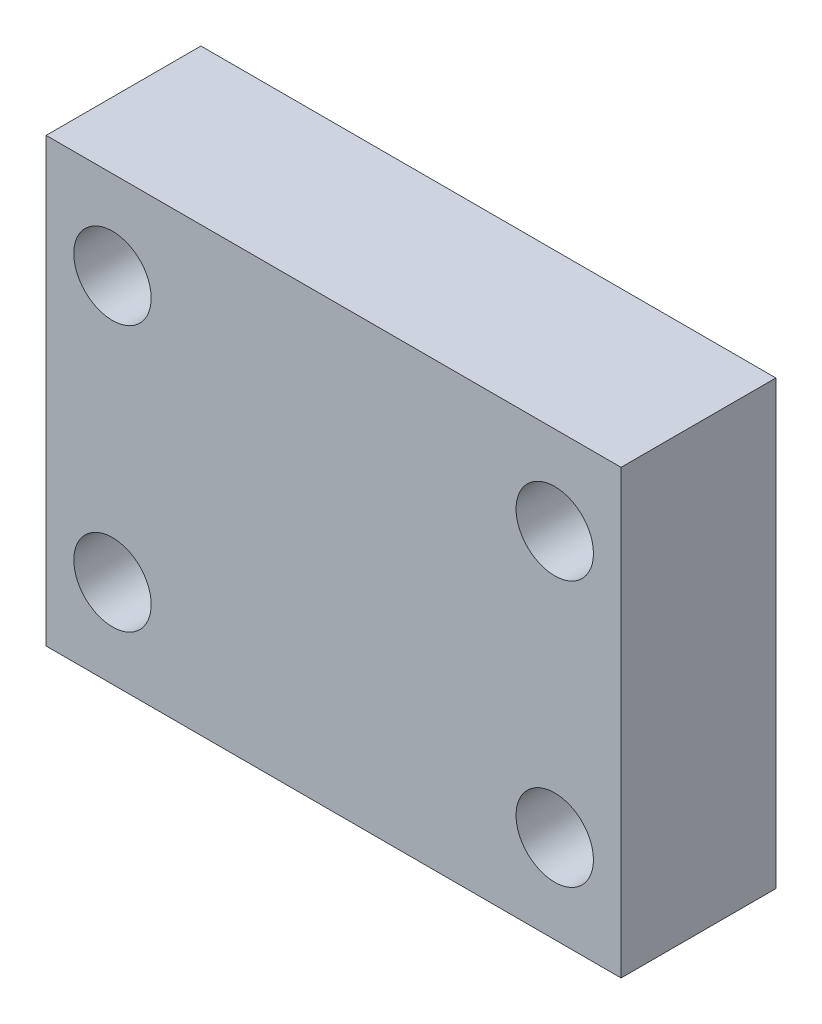
from build123d import *

# Parameters (mm, degrees)
SKETCH1_W           = 52
SKETCH1_H           = 40
SKETCH1_R           = 3.5
BOSS_EXTRUDE1_DEPTH = 14


with BuildPart() as part:
    # Sketch1 → Boss-Extrude1 (new body)
    with BuildSketch(Plane.XY):
        with Locations((26, -20)):
            Rectangle(SKETCH1_W, SKETCH1_H)
        with Locations((6, -8)):
            Circle(SKETCH1_R, mode=Mode.SUBTRACT)
        with Locations((46, -8)):
            Circle(SKETCH1_R, mode=Mode.SUBTRACT)
        with Locations((6, -32)):
            Circle(SKETCH1_R, mode=Mode.SUBTRACT)
        with Locations((46, -32)):
            Circle(SKETCH1_R, mode=Mode.SUBTRACT)
    extrude(amount=BOSS_EXTRUDE1_DEPTH)


solid = part.part
